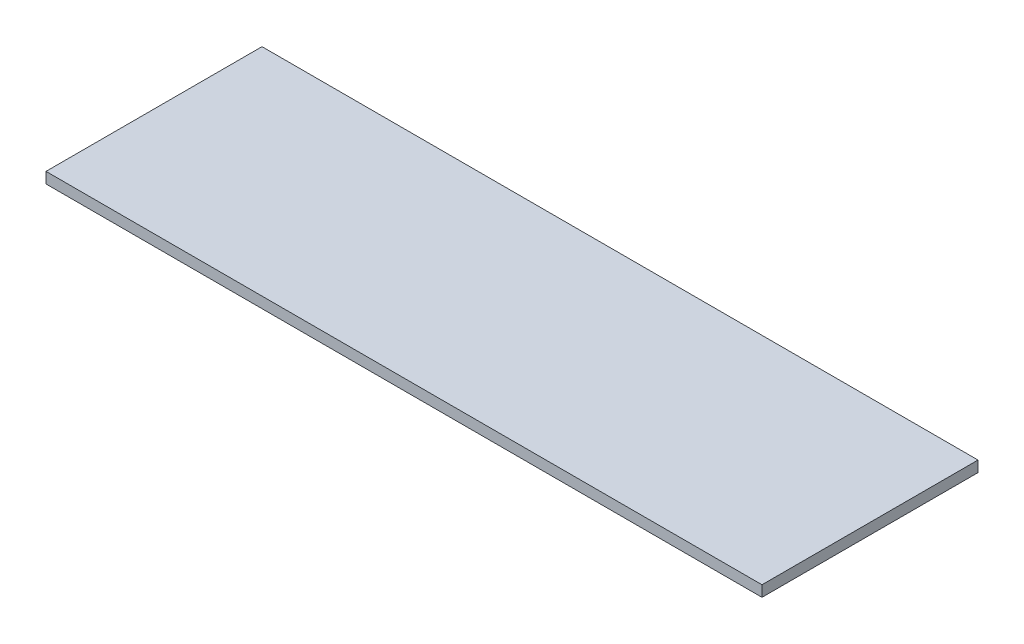
from build123d import *

# Parameters (mm, degrees)
SKETCH1_W           = 295
SKETCH1_H           = 89
BOSS_EXTRUDE1_DEPTH = 4.5


with BuildPart() as part:
    # Sketch1 → Boss-Extrude1 (new body)
    with BuildSketch(Plane(origin=(0, 0, 0), x_dir=(1, 0, 0), z_dir=(0, 1, 0))):
        Rectangle(SKETCH1_W, SKETCH1_H)
    extrude(amount=BOSS_EXTRUDE1_DEPTH)


solid = part.part
